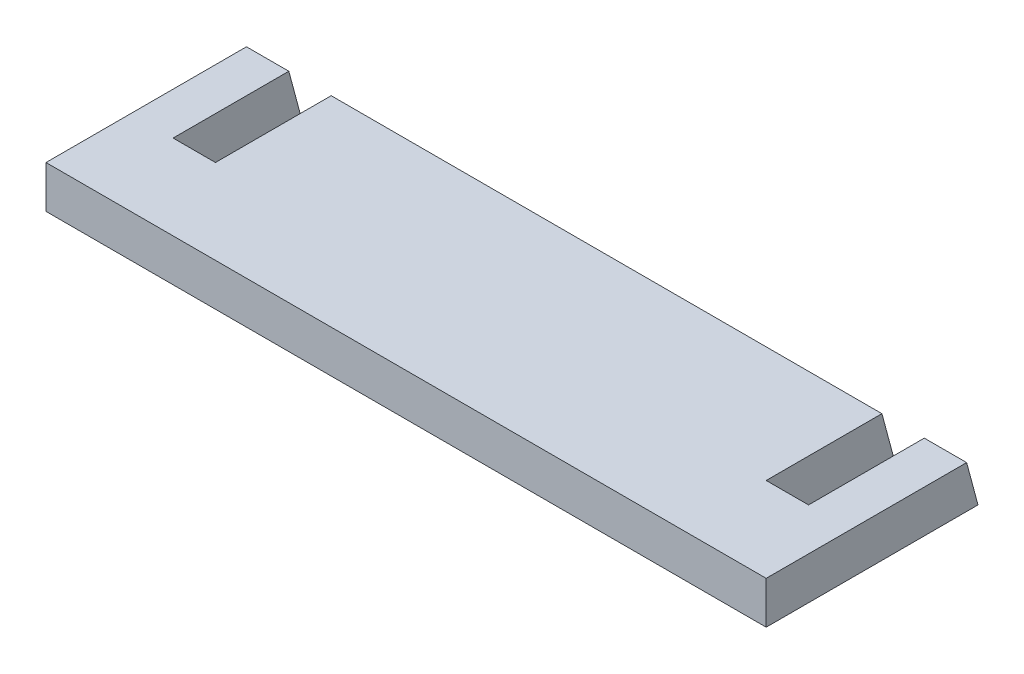
from build123d import *

# Parameters (mm, degrees)
SKETCH2_W           = 170
SKETCH2_H           = 50
BOSS_EXTRUDE1_DEPTH = 10
CHAMFER1_SIZE2      = 2.679491924
CHAMFER1_SIZE       = 10
SKETCH4_W           = 10
SKETCH4_H           = 30
CUT_EXTRUDE1_DEPTH  = 10


with BuildPart() as part:
    # Sketch2 → Boss-Extrude1 (new body)
    with BuildSketch(Plane(origin=(0, 0, 0), x_dir=(1, 0, 0), z_dir=(0, 1, 0))):
        Rectangle(SKETCH2_W, SKETCH2_H)
    extrude(amount=BOSS_EXTRUDE1_DEPTH)

    # Chamfer1
    chamfer1_edges = [part.edges().sort_by_distance(p)[0] for p in [
        (0, 10, -25),
    ]]
    chamfer1_side = [part.faces().sort_by_distance(p)[0] for p in [
        (0, 9.946410162, -25),
    ]]
    chamfer(chamfer1_edges, length=CHAMFER1_SIZE - 0.0001, length2=CHAMFER1_SIZE2 - 0.0001, reference=chamfer1_side[0])  # a hair under: the kernel refuses the full size

    # Sketch4 → Cut-Extrude1 (cut)
    with BuildSketch(Plane(origin=(0, 0, 0), x_dir=(1, 0, 0), z_dir=(0, 1, 0))):
        with Locations((70, 10)):
            Rectangle(SKETCH4_W, SKETCH4_H)
        with Locations((-70, 10)):
            Rectangle(SKETCH4_W, SKETCH4_H)
    extrude(amount=CUT_EXTRUDE1_DEPTH, mode=Mode.SUBTRACT)


solid = part.part
